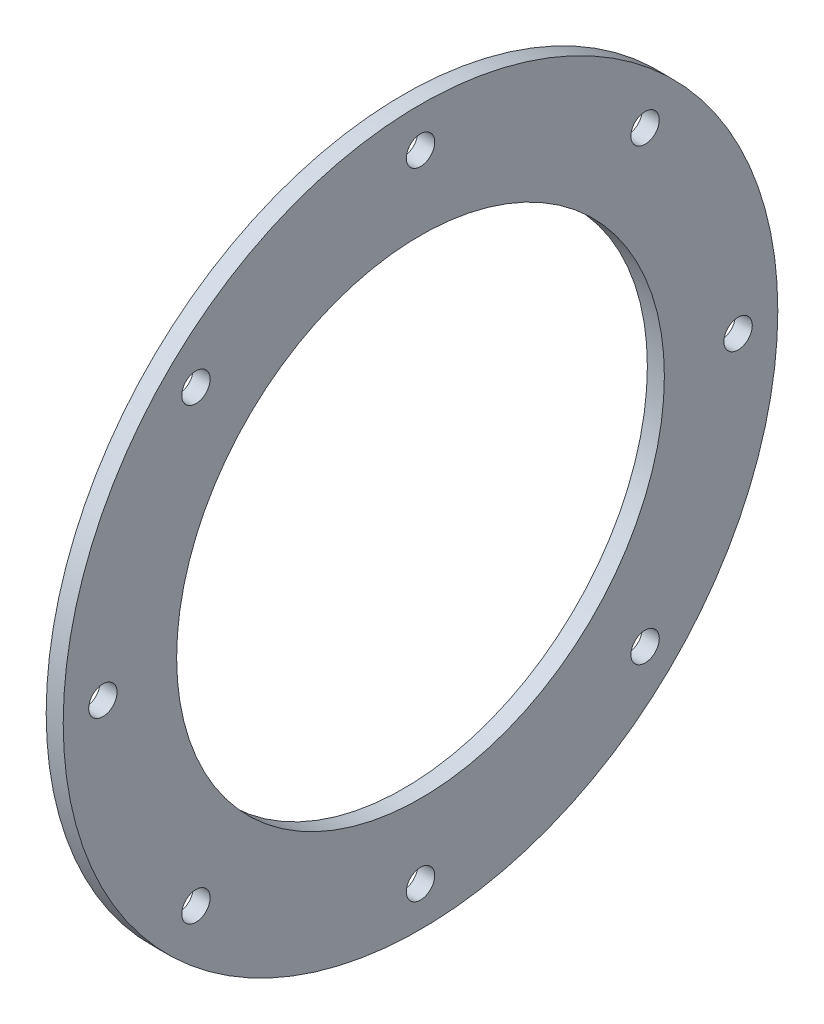
from build123d import *

# Parameters (mm, degrees)
SZKIC1_R                    = 63
SZKIC1_R_2                  = 43
SZKIC1_R_3                  = 2.5
DODANIE_WYCI_GNI_CIE1_DEPTH = 3


with BuildPart() as part:
    # Szkic1 → Dodanie-wyciągnięcie1 (new body)
    with BuildSketch(Plane(origin=(0, 0, 0), x_dir=(0, 0, -1), z_dir=(1, 0, 0))):
        Circle(SZKIC1_R)
        Circle(SZKIC1_R_2, mode=Mode.SUBTRACT)
        with Locations((0, 56)):
            Circle(SZKIC1_R_3, mode=Mode.SUBTRACT)
        with Locations((39.597979746, 39.597979746)):
            Circle(SZKIC1_R_3, mode=Mode.SUBTRACT)
        with Locations((56, 0)):
            Circle(SZKIC1_R_3, mode=Mode.SUBTRACT)
        with Locations((39.597979746, -39.597979746)):
            Circle(SZKIC1_R_3, mode=Mode.SUBTRACT)
        with Locations((0, -56)):
            Circle(SZKIC1_R_3, mode=Mode.SUBTRACT)
        with Locations((-39.597979746, -39.597979746)):
            Circle(SZKIC1_R_3, mode=Mode.SUBTRACT)
        with Locations((-56, 0)):
            Circle(SZKIC1_R_3, mode=Mode.SUBTRACT)
        with Locations((-39.597979746, 39.597979746)):
            Circle(SZKIC1_R_3, mode=Mode.SUBTRACT)
    extrude(amount=DODANIE_WYCI_GNI_CIE1_DEPTH)


solid = part.part
